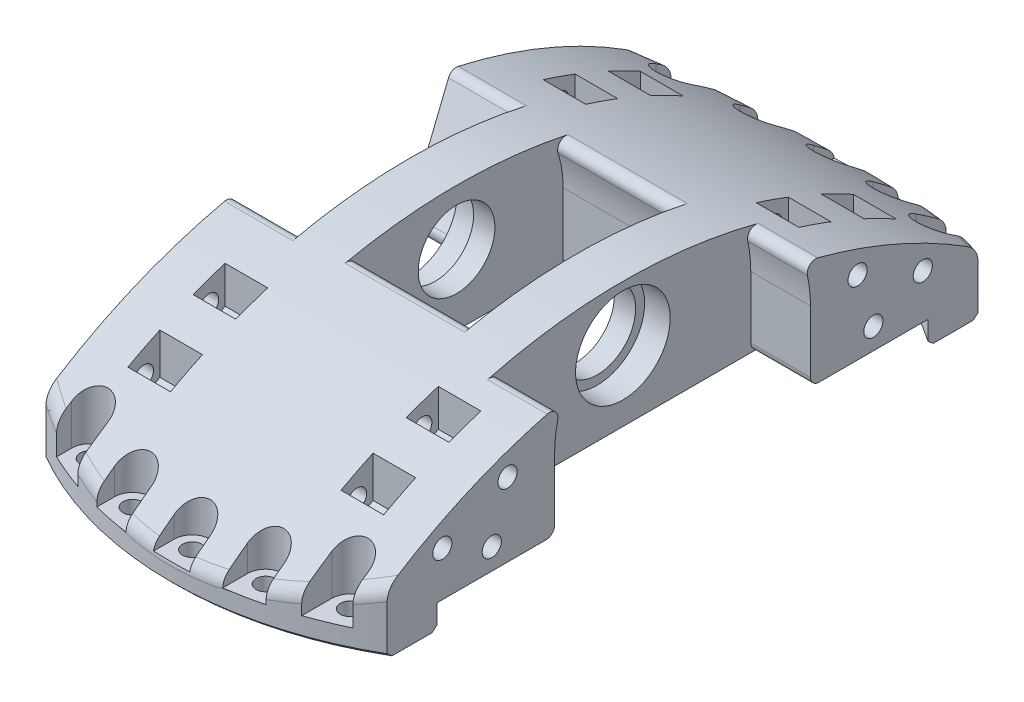
from build123d import *

# Parameters (mm, degrees)
SKETCH1_R                = 80
BOSS_EXTRUDE1_DEPTH      = 190
FILLET2_R                = 40
CUT_EXTRUDE1_DEPTH       = 222.133443875
CUT_EXTRUDE1_DEPTH_BACK  = 53
SKETCH2_R                = 57.5
SKETCH14_R               = 55
CUT_EXTRUDE15_DEPTH      = 222.133444033
CUT_EXTRUDE17_START      = -58.094750577
CUT_EXTRUDE17_DEPTH      = 116.189501174
SKETCH3_R                = 426.11742707
SKETCH3_R_2              = 125
CUT_EXTRUDE2_DEPTH       = 40
CUT_EXTRUDE3_DEPTH       = 222.133444033
CUT_EXTRUDE3_DEPTH_BACK  = 222.133444033
SKETCH4_R                = 9
CUT_EXTRUDE9_START       = 26
SKETCH8_R                = 30
CUT_EXTRUDE9_DEPTH       = 28
CUT_EXTRUDE10_DEPTH      = 15
CUT_EXTRUDE10_DEPTH_BACK = 13
SKETCH9_R                = 25
CUT_EXTRUDE13_START      = -24
SKETCH12_R               = 15
CUT_EXTRUDE13_DEPTH      = 198.133444034
SKETCH10_R               = 11.1
CUT_EXTRUDE11_DEPTH      = 6
CUT_EXTRUDE12_START      = -6
SKETCH11_R               = 11.1
CUT_EXTRUDE12_DEPTH      = 6
CUT_EXTRUDE14_START      = -40
CUT_EXTRUDE14_DEPTH      = 16
CUT_EXTRUDE19_START      = -40
CUT_EXTRUDE19_DEPTH      = 12
CUT_EXTRUDE20_DEPTH      = 245.793790936
CUT_EXTRUDE21_START      = -56
CUT_EXTRUDE21_DEPTH      = 166.133444034
CUT_EXTRUDE22_START      = 25
SKETCH18_R               = 2.5
CUT_EXTRUDE22_DEPTH      = 197.133444034
CUT_EXTRUDE23_START      = 51
CUT_EXTRUDE23_DEPTH      = 10
CUT_EXTRUDE24_START      = 57
SKETCH18_4_R             = 5
CUT_EXTRUDE24_DEPTH      = 165.133444034
CUT_EXTRUDE26_START      = 59
SKETCH12_3_R             = 15
CUT_EXTRUDE26_DEPTH      = 163.133444034
SKETCH_1_R               = 70.1
CUT_EXTRUDE_1_DEPTH      = 5.5
CUT_DEPTH                = 191
FILLET_2_R               = 4
FILLET_1_R               = 2
SKETCH19_R               = 2.25
CUT_EXTRUDE25_DEPTH      = 30
CUT_EXTRUDE_START        = -5
SKETCH19_3_R             = 4.25
SKETCH19_3_R_2           = 2.25
SKETCH19_3_W             = 8.5
SKETCH19_3_H             = 15.240718906
SKETCH19_3_H_2           = 12.897835649
SKETCH19_3_H_3           = 18.642909687
SKETCH19_3_H_4           = 21.20084727
SKETCH19_3_H_5           = 30.368123641
CUT_EXTRUDE_4_DEPTH      = 92.046864094
CHAMFER_1_SIZE           = 1
CUT_EXTRUDE_5_DEPTH      = 97.046864094
CUT_EXTRUDE_5_DEPTH_BACK = 97.046864094
SKETCH_3_R               = 2.25
CUT_EXTRUDE_START_2      = 30
CUT_EXTRUDE_6_DEPTH      = 10
MIRROR_START             = 30
MIRROR_3_COPY_1_DEPTH    = 10


with BuildPart() as part:
    # Sketch1 → Boss-Extrude1 (new body)
    with BuildSketch(Plane(origin=(0, 0, 0), x_dir=(1, 0, 0), z_dir=(0, 1, 0))):
        with Locations(Location((0, 0, 0), (0, 0, 270))):
            Circle(SKETCH1_R)
    extrude(amount=BOSS_EXTRUDE1_DEPTH)

    # Fillet2
    fillet2_edges = [part.edges().sort_by_distance(p)[0] for p in [
        (0, 190, -80),
    ]]
    fillet(fillet2_edges, radius=FILLET2_R)

    # Sketch2 → Cut-Extrude1 (cut, two sides: drawn at the far end of the back side and taken through both)
    with BuildSketch(Plane(origin=(0, 0, 0), x_dir=(0, 0, -1), z_dir=(1, 0, 0)).offset(-CUT_EXTRUDE1_DEPTH_BACK)):
        with Locations(Location((0, 125, 0), (0, 0, 154.228538259))):
            Circle(SKETCH2_R)
    extrude(amount=CUT_EXTRUDE1_DEPTH + CUT_EXTRUDE1_DEPTH_BACK, mode=Mode.SUBTRACT)

    # Sketch14 → Cut-Extrude15 (cut, through all)
    with BuildSketch(Plane(origin=(0, 0, 0), x_dir=(0, 0, -1), z_dir=(1, 0, 0))):
        with Locations((0, 125)):
            Circle(SKETCH14_R)
    extrude(amount=-CUT_EXTRUDE15_DEPTH, mode=Mode.SUBTRACT)

    # Cut-Extrude17: read off the stored shape, not the designer's step
    # Cut-Extrude17 outline → Cut-Extrude17 (cut)
    with BuildSketch(Plane(origin=(0, 0, 0), x_dir=(0, 0, -1), z_dir=(1, 0, 0)).offset(CUT_EXTRUDE17_START)):
        with BuildLine():
            ThreePointArc((-60.517241379, 101.279471004), (-53.697459832, 161.62762356), (0, 190))
            Line((0, 190), (0, 244.678558545))
            Line((0, 244.678558545), (-201.158911257, 244.678558545))
            Line((-201.158911257, 244.678558545), (-201.158911257, 27.107218596))
            ThreePointArc((-201.158911257, 27.107218596), (-97.681072288, 1.322712407), (-60.517241379, 101.279471004))
        make_face()
    cut_extrude17 = extrude(amount=CUT_EXTRUDE17_DEPTH, mode=Mode.SUBTRACT)

    # Mirror1: Cut-Extrude17 across plane
    add(cut_extrude17.mirror(Plane.XY), mode=Mode.SUBTRACT)

    # Sketch3 → Cut-Extrude2 (cut, symmetric)
    # profile 1 of 2: a face of its own
    with BuildSketch(Plane(origin=(0, 0, 0), x_dir=(0, 0, -1), z_dir=(1, 0, 0))):
        Circle(SKETCH3_R)
        with Locations((0, -90)):
            Circle(SKETCH3_R_2, mode=Mode.SUBTRACT)
    # profile 2 of 2: a face of its own
    with BuildSketch(Plane(origin=(0, 0, 0), x_dir=(0, 0, -1), z_dir=(1, 0, 0))):
        Circle(SKETCH3_R)
        with BuildLine():
            ThreePointArc((0, 35), (88.388347648, -1.611652352), (125, -90))
            ThreePointArc((125, -90), (-88.388347648, -178.388347648), (0, 35))
        make_face(mode=Mode.SUBTRACT)
    extrude(amount=CUT_EXTRUDE2_DEPTH, both=True, mode=Mode.SUBTRACT)

    # Sketch4 → Cut-Extrude3 (cut, two sides: drawn at the far end of the back side and taken through both)
    with BuildSketch(Plane(origin=(0, 0, 0), x_dir=(0, 0, -1), z_dir=(1, 0, 0)).offset(-CUT_EXTRUDE3_DEPTH_BACK)):
        with Locations((0, 22)):
            Circle(SKETCH4_R)
    extrude(amount=CUT_EXTRUDE3_DEPTH + CUT_EXTRUDE3_DEPTH_BACK, mode=Mode.SUBTRACT)

    # Sketch8 → Cut-Extrude9 (cut)
    with BuildSketch(Plane(origin=(0, 0, 0), x_dir=(0, 0, -1), z_dir=(1, 0, 0)).offset(CUT_EXTRUDE9_START)):
        with Locations((0, 22)):
            Circle(SKETCH8_R)
        with BuildLine():
            ThreePointArc((30, 22), (0, -8), (-30, 22))
            Line((-30, 22), (-30, -22.608162648))
            Line((-30, -22.608162648), (30, -22.608162648))
            Line((30, -22.608162648), (30, 22))
        make_face()
    extrude(amount=CUT_EXTRUDE9_DEPTH, mode=Mode.SUBTRACT)

    # Sketch9 → Cut-Extrude10 (cut, two sides: drawn at the far end of the back side and taken through both)
    with BuildSketch(Plane(origin=(0, 0, 0), x_dir=(0, 0, -1), z_dir=(1, 0, 0)).offset(-CUT_EXTRUDE10_DEPTH_BACK)):
        with Locations((0, 22)):
            Circle(SKETCH9_R)
        with BuildLine():
            ThreePointArc((25, 22), (0, -3), (-25, 22))
            Line((-25, 22), (-25, -23.840530069))
            Line((-25, -23.840530069), (25, -23.840530069))
            Line((25, -23.840530069), (25, 22))
        make_face()
    extrude(amount=CUT_EXTRUDE10_DEPTH + CUT_EXTRUDE10_DEPTH_BACK, mode=Mode.SUBTRACT)

    # Sketch12 → Cut-Extrude13 (cut, through all)
    with BuildSketch(Plane(origin=(0, 0, 0), x_dir=(0, 0, -1), z_dir=(1, 0, 0)).offset(CUT_EXTRUDE13_START)):
        with Locations(Location((0, 22, 0), (0, 0, 58.211669383))):
            Circle(SKETCH12_R)
    extrude(amount=-CUT_EXTRUDE13_DEPTH, mode=Mode.SUBTRACT)

    # Sketch10 → Cut-Extrude11 (cut)
    with BuildSketch(Plane.ZY.offset(24)):
        with Locations((0, 22)):
            Circle(SKETCH10_R)
    extrude(amount=-CUT_EXTRUDE11_DEPTH, mode=Mode.SUBTRACT)

    # Sketch11 → Cut-Extrude12 (cut)
    with BuildSketch(Plane(origin=(26, 0, 0), x_dir=(0, 0, -1), z_dir=(1, 0, 0)).offset(CUT_EXTRUDE12_START)):
        with Locations(Location((0, 22, 0), (0, 0, 180))):
            Circle(SKETCH11_R)
    extrude(amount=CUT_EXTRUDE12_DEPTH, mode=Mode.SUBTRACT)

    # Cut-Extrude14: read off the stored shape, not the designer's step
    # Cut-Extrude14 outline → Cut-Extrude14 (cut)
    with BuildSketch(Plane(origin=(0, 0, 0), x_dir=(0, 0, -1), z_dir=(1, 0, 0)).offset(CUT_EXTRUDE14_START)):
        with BuildLine():
            Line((-25.740637233, 32.320969563), (-18.543677091, 14.507868132))
            ThreePointArc((-18.543677091, 14.507868132), (0, 2), (18.543677091, 14.507868132))
            Line((18.543677091, 14.507868132), (25.740637233, 32.320969563))
            ThreePointArc((25.740637233, 32.320969563), (16.864976697, 33.857065043), (7.901740315, 34.75))
            ThreePointArc((7.901740315, 34.75), (0, 7), (-7.901740315, 34.75))
            ThreePointArc((-7.901740315, 34.75), (-16.864976697, 33.857065043), (-25.740637233, 32.320969563))
        make_face()
    extrude(amount=CUT_EXTRUDE14_DEPTH, mode=Mode.SUBTRACT)

    # Sketch16 → Cut-Extrude19 (cut)
    with BuildSketch(Plane(origin=(0, 0, 0), x_dir=(0, 0, -1), z_dir=(1, 0, 0)).offset(CUT_EXTRUDE19_START)):
        with BuildLine():
            Line((-29, 57), (-14, 57))
            ThreePointArc((-14, 57), (-4, 47), (-14, 37))
            Line((-14, 37), (-29, 37))
            Line((-29, 37), (-39, 37))
            ThreePointArc((-39, 37), (-49, 47), (-39, 57))
            Line((-39, 57), (-29, 57))
        make_face()
    extrude(amount=-CUT_EXTRUDE19_DEPTH, mode=Mode.SUBTRACT)

    # Sketch17 → Cut-Extrude20 (cut, through all)
    with BuildSketch(Plane(origin=(-52, 0, 0), x_dir=(0, 0, -1), z_dir=(1, 0, 0))):
        with BuildLine():
            Line((-39, 52), (-14, 52))
            ThreePointArc((-14, 52), (-9, 47), (-14, 42))
            Line((-14, 42), (-39, 42))
            ThreePointArc((-39, 42), (-44, 47), (-39, 52))
        make_face()
    extrude(amount=-CUT_EXTRUDE20_DEPTH, mode=Mode.SUBTRACT)

    # Sketch16<3> → Cut-Extrude21 (cut, through all)
    with BuildSketch(Plane(origin=(0, 0, 0), x_dir=(0, 0, -1), z_dir=(1, 0, 0)).offset(CUT_EXTRUDE21_START)):
        with BuildLine():
            ThreePointArc((-14, 37), (-4, 47), (-14, 57))
            Line((-14, 57), (-29, 57))
            Line((-29, 57), (-39, 57))
            ThreePointArc((-39, 57), (-49, 47), (-39, 37))
            Line((-39, 37), (-29, 37))
            Line((-29, 37), (-14, 37))
        make_face()
    extrude(amount=-CUT_EXTRUDE21_DEPTH, mode=Mode.SUBTRACT)

    # Sketch18 → Cut-Extrude22 (cut, through all)
    with BuildSketch(Plane.XY.offset(CUT_EXTRUDE22_START)):
        with Locations(Location((-46, 47, 0), (0, 0, 180))):
            Circle(SKETCH18_R)
    extrude(amount=CUT_EXTRUDE22_DEPTH, mode=Mode.SUBTRACT)

    # Sketch18<3> → Cut-Extrude23 (cut)
    with BuildSketch(Plane.XY.offset(CUT_EXTRUDE23_START)):
        Polygon((-46, 51.907477288), (-50.25, 49.453738644), (-50.25, 44.546261356), (-46, 42.092522712), (-41.75, 44.546261356), (-41.75, 49.453738644), align=None)
    extrude(amount=-CUT_EXTRUDE23_DEPTH, mode=Mode.SUBTRACT)

    # Sketch18<4> → Cut-Extrude24 (cut, through all)
    with BuildSketch(Plane.XY.offset(CUT_EXTRUDE24_START)):
        with Locations(Location((-46, 47, 0), (0, 0, 180))):
            Circle(SKETCH18_4_R)
    extrude(amount=CUT_EXTRUDE24_DEPTH, mode=Mode.SUBTRACT)

    # Sketch12<3> → Cut-Extrude26 (cut, through all)
    with BuildSketch(Plane(origin=(0, 0, 0), x_dir=(0, 0, -1), z_dir=(1, 0, 0)).offset(CUT_EXTRUDE26_START)):
        with Locations((0, 22)):
            Circle(SKETCH12_3_R)
    extrude(amount=CUT_EXTRUDE26_DEPTH, mode=Mode.SUBTRACT)

    # Эскиз1 → Вырез-Вытянуть1 (cut)
    with BuildSketch(Plane.XZ):
        with Locations(Location((0, 0, 0), (0, 0, 270))):
            Circle(SKETCH_1_R)
    extrude(amount=-CUT_EXTRUDE_1_DEPTH, mode=Mode.SUBTRACT)

    # CUT: read off the stored shape, not the designer's step
    # CUT outline → CUT (cut)
    with BuildSketch(Plane(origin=(0, 0, 0), x_dir=(1, 0, 0), z_dir=(0, 1, 0))):
        with BuildLine():
            ThreePointArc((40, -69.282032303), (80, 0), (40, 69.282032303))
            Line((40, 69.282032303), (40, -69.282032303))
        make_face()
        with BuildLine():
            Line((-40, -69.282032303), (-40, 69.282032303))
            ThreePointArc((-40, 69.282032303), (-80, 0), (-40, -69.282032303))
        make_face()
    extrude(amount=CUT_DEPTH, mode=Mode.SUBTRACT)

    # Скругление2
    fillet_2_edges = [part.edges().sort_by_distance(p)[0] for p in [
        (0, 6.046863561, -80),
        (0, 6.046863561, 80),
    ]]
    fillet(fillet_2_edges, radius=FILLET_2_R)

    # Скругление1
    fillet_1_edges = [part.edges().sort_by_distance(p)[0] for p in [
        (33, 31.736607143, 28.376019477),
        (33, 31.736607143, -28.376019477),
        (1, 32.964285714, -22.467408368),
        (1, 32.964285714, 22.467408368),
        (-32, 32.320969563, -25.740637233),
        (-32, 32.320969563, 25.740637233),
        (-32, 5.5, 11.302654555),
        (-32, 5.5, -11.302654555),
        (1, 5.5, 25),
        (1, 5.5, -25),
        (33, 5.5, -30),
        (33, 5.5, 30),
    ]]
    fillet(fillet_1_edges, radius=FILLET_1_R)

    # Sketch19 → Cut-Extrude25 (cut)
    with BuildSketch(Plane.XZ):
        with Locations(Location((0, 75, 0), (0, 0, 270))):
            Circle(SKETCH19_R)
        with Locations(Location((15.593376811, 73.361070055, 0), (0, 0, 270))):
            Circle(SKETCH19_R)
        with Locations(Location((30.505248231, 68.515909323, 0), (0, 0, 270))):
            Circle(SKETCH19_R)
        with Locations(Location((-30.505248231, 68.515909323, 0), (0, 0, 270))):
            Circle(SKETCH19_R)
        with Locations(Location((-15.593376811, 73.361070055, 0), (0, 0, 270))):
            Circle(SKETCH19_R)
    cut_extrude25 = extrude(amount=-CUT_EXTRUDE25_DEPTH, mode=Mode.SUBTRACT)

    # Sketch19<3> → Вырез-Вытянуть4 (cut, through all)
    # profile 1 of 10: a face of its own
    with BuildSketch(Plane.XZ.offset(CUT_EXTRUDE_START)):
        with Locations((30.505248231, 68.515909323)):
            Circle(SKETCH19_3_R)
        with Locations(Location((30.505248231, 68.515909323, 0), (0, 0, 270))):
            Circle(SKETCH19_3_R_2, mode=Mode.SUBTRACT)
    # profile 2 of 10: a face of its own
    with BuildSketch(Plane.XZ.offset(CUT_EXTRUDE_START)):
        with Locations((15.593376811, 73.361070055)):
            Circle(SKETCH19_3_R)
        with Locations(Location((15.593376811, 73.361070055, 0), (0, 0, 270))):
            Circle(SKETCH19_3_R_2, mode=Mode.SUBTRACT)
    # profile 3 of 10: a face of its own
    with BuildSketch(Plane.XZ.offset(CUT_EXTRUDE_START)):
        with Locations((0, 75)):
            Circle(SKETCH19_3_R)
        with Locations(Location((0, 75, 0), (0, 0, 270))):
            Circle(SKETCH19_3_R_2, mode=Mode.SUBTRACT)
    # profile 4 of 10: a face of its own
    with BuildSketch(Plane.XZ.offset(CUT_EXTRUDE_START)):
        with Locations((-15.593376811, 73.361070055)):
            Circle(SKETCH19_3_R)
        with Locations(Location((-15.593376811, 73.361070055, 0), (0, 0, 270))):
            Circle(SKETCH19_3_R_2, mode=Mode.SUBTRACT)
    # profile 5 of 10: a face of its own
    with BuildSketch(Plane.XZ.offset(CUT_EXTRUDE_START)):
        with Locations((-30.505248231, 68.515909323)):
            Circle(SKETCH19_3_R)
        with Locations(Location((-30.505248231, 68.515909323, 0), (0, 0, 270))):
            Circle(SKETCH19_3_R_2, mode=Mode.SUBTRACT)
    # profile 6 of 10: a face of its own
    with BuildSketch(Plane.XZ.offset(CUT_EXTRUDE_START)):
        with Locations((-30.505248231, 76.136268776)):
            Rectangle(SKETCH19_3_W, SKETCH19_3_H)
    # profile 7 of 10: a face of its own
    with BuildSketch(Plane.XZ.offset(CUT_EXTRUDE_START)):
        with Locations((-15.593376811, 79.809987879)):
            Rectangle(SKETCH19_3_W, SKETCH19_3_H_2)
    # profile 8 of 10: a face of its own
    with BuildSketch(Plane.XZ.offset(CUT_EXTRUDE_START)):
        with Locations((0, 84.321454843)):
            Rectangle(SKETCH19_3_W, SKETCH19_3_H_3)
    # profile 9 of 10: a face of its own
    with BuildSketch(Plane.XZ.offset(CUT_EXTRUDE_START)):
        with Locations((15.593376811, 83.96149369)):
            Rectangle(SKETCH19_3_W, SKETCH19_3_H_4)
    # profile 10 of 10: a face of its own
    with BuildSketch(Plane.XZ.offset(CUT_EXTRUDE_START)):
        with Locations((30.505248231, 83.699971143)):
            Rectangle(SKETCH19_3_W, SKETCH19_3_H_5)
    cut_extrude_4 = extrude(amount=-CUT_EXTRUDE_4_DEPTH, mode=Mode.SUBTRACT)

    # Зеркальное отражение1: Cut-Extrude25, Вырез-Вытянуть4 across plane
    add(cut_extrude25.mirror(Plane.XY), mode=Mode.SUBTRACT)
    add(cut_extrude_4.mirror(Plane.XY), mode=Mode.SUBTRACT)

    # Фаска1
    chamfer_1_edges = [part.edges().sort_by_distance(p)[0] for p in [
        (0, 0, 70.1),
        (0, 0, -70.1),
        (0, 0, -80),
        (0, 0, 80),
    ]]
    chamfer(chamfer_1_edges, length=CHAMFER_1_SIZE)

    # Эскиз3 → Вырез-Вытянуть5 (cut, two sides: drawn at the far end of the back side and taken through both)
    with BuildSketch(Plane(origin=(0, 0, 0), x_dir=(0, 0, -1), z_dir=(1, 0, 0)).offset(-CUT_EXTRUDE_5_DEPTH_BACK)):
        with Locations((44.741030738, 10.490000341)):
            Circle(SKETCH_3_R)
        with Locations((56.336587534, 15.953711143)):
            Circle(SKETCH_3_R)
        with Locations((41.042417199, 22.763114494)):
            Circle(SKETCH_3_R)
        with Locations((-41.042417199, 22.763114494)):
            Circle(SKETCH_3_R)
        with Locations((-56.336587534, 15.953711143)):
            Circle(SKETCH_3_R)
        with Locations((-44.741030738, 10.490000341)):
            Circle(SKETCH_3_R)
    extrude(amount=CUT_EXTRUDE_5_DEPTH + CUT_EXTRUDE_5_DEPTH_BACK, mode=Mode.SUBTRACT)

    # Эскиз4 → Вырез-Вытянуть6 (cut)
    with BuildSketch(Plane(origin=(0, 0, 0), x_dir=(0, 0, -1), z_dir=(1, 0, 0)).offset(CUT_EXTRUDE_START_2)):
        Polygon((-60.086587534, 18.118774653), (-52.586587534, 18.118774653), (-52.586587534, 13.788647634), (-56.336587534, 11.623584124), (-60.086587534, 13.788647634), align=None)
        Polygon((-60.086587534, 34.666207072), (-52.586587534, 34.666207072), (-52.586587534, 18.118774653), (-56.336587534, 20.283838162), (-60.086587534, 18.118774653), align=None)
        Polygon((-56.336587534, 20.283838162), (-60.086587534, 18.118774653), (-52.586587534, 18.118774653), align=None)
        Polygon((-44.792417199, 24.928178004), (-37.292417199, 24.928178004), (-37.292417199, 20.598050985), (-41.042417199, 18.432987475), (-44.792417199, 20.598050985), align=None)
        Polygon((-41.042417199, 27.093241513), (-44.792417199, 24.928178004), (-37.292417199, 24.928178004), align=None)
        Polygon((-44.792417199, 34.215238553), (-37.292417199, 34.215238553), (-37.292417199, 24.928178004), (-41.042417199, 27.093241513), (-44.792417199, 24.928178004), align=None)
        Polygon((-48.491030738, 12.65506385), (-48.491030738, 8.324936831), (-40.991030738, 8.324936831), (-40.991030738, 12.65506385), (-44.741030738, 14.82012736), align=None)
        Polygon((-48.491030738, 8.324936831), (-40.991030738, 8.324936831), (-44.741030738, 6.159873322), align=None)
        Polygon((-48.491030738, 8.324936831), (-48.491030738, -0.659660254), (-40.991030738, -0.659660254), (-40.991030738, 8.324936831), (-44.741030738, 6.159873322), align=None)
    cut_extrude_6 = extrude(amount=-CUT_EXTRUDE_6_DEPTH, mode=Mode.SUBTRACT)

    # Зеркальное отражение2: Вырез-Вытянуть6 across plane
    add(cut_extrude_6.mirror(Plane(origin=(0, 0, 0), x_dir=(0, 0, 1), z_dir=(1, 0, 0))), mode=Mode.SUBTRACT)

    # Зеркальное отражение3: Вырез-Вытянуть6 across plane
    add(cut_extrude_6.mirror(Plane.XY), mode=Mode.SUBTRACT)

    # Зеркальное отражение3 copy 1 sketch → Зеркальное отражение3 copy 1 (cut)
    with BuildSketch(Plane.ZY.offset(MIRROR_START)):
        Polygon((-60.086587534, 18.118774653), (-52.586587534, 18.118774653), (-52.586587534, 13.788647634), (-56.336587534, 11.623584124), (-60.086587534, 13.788647634), align=None)
        Polygon((-60.086587534, 34.666207072), (-52.586587534, 34.666207072), (-52.586587534, 18.118774653), (-56.336587534, 20.283838162), (-60.086587534, 18.118774653), align=None)
        Polygon((-56.336587534, 20.283838162), (-60.086587534, 18.118774653), (-52.586587534, 18.118774653), align=None)
        Polygon((-44.792417199, 24.928178004), (-37.292417199, 24.928178004), (-37.292417199, 20.598050985), (-41.042417199, 18.432987475), (-44.792417199, 20.598050985), align=None)
        Polygon((-41.042417199, 27.093241513), (-44.792417199, 24.928178004), (-37.292417199, 24.928178004), align=None)
        Polygon((-44.792417199, 34.215238553), (-37.292417199, 34.215238553), (-37.292417199, 24.928178004), (-41.042417199, 27.093241513), (-44.792417199, 24.928178004), align=None)
        Polygon((-48.491030738, 12.65506385), (-48.491030738, 8.324936831), (-40.991030738, 8.324936831), (-40.991030738, 12.65506385), (-44.741030738, 14.82012736), align=None)
        Polygon((-48.491030738, 8.324936831), (-40.991030738, 8.324936831), (-44.741030738, 6.159873322), align=None)
        Polygon((-48.491030738, 8.324936831), (-48.491030738, -0.659660254), (-40.991030738, -0.659660254), (-40.991030738, 8.324936831), (-44.741030738, 6.159873322), align=None)
    extrude(amount=-MIRROR_3_COPY_1_DEPTH, mode=Mode.SUBTRACT)


solid = part.part
